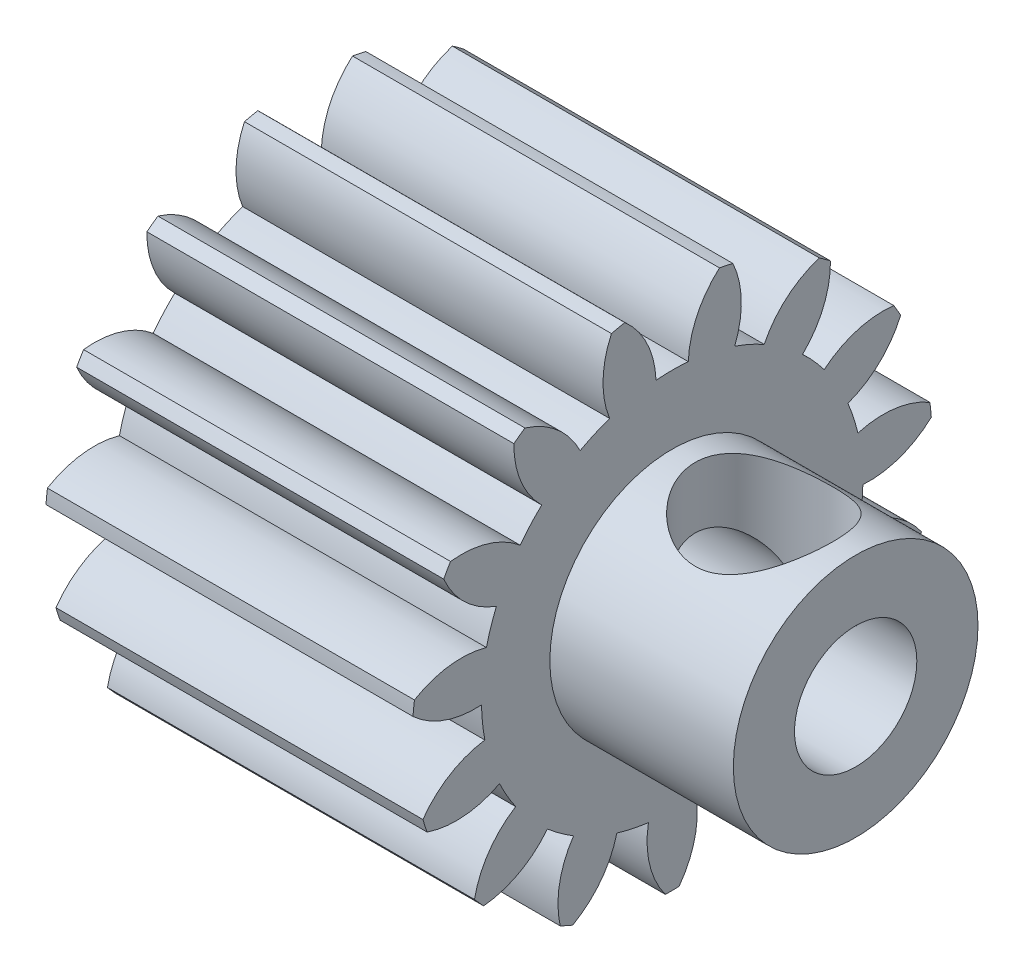
from build123d import *

# Parameters (mm, degrees)
SPUR_START             = -93.736960043
SPUR_GEAR_AI_OUTLINE_R = 1.5875
SPUR_GEAR_AI_DEPTH     = 9.525
SKETCH1_R              = 3.175
SKETCH1_R_2            = 1.5875
BOSS_EXTRUDE1_DEPTH    = 4.7625
SKETCH2_R              = 1.7859375
CUT_EXTRUDE1_DEPTH     = 3.175


# Read off the part's stored shape, not the designer's step: spur gear_ai
with BuildPart() as part:
    # spur gear_ai outline → spur gear_ai (new body)
    with BuildSketch(Plane.YZ.offset(SPUR_START)):
        with BuildLine():
            ThreePointArc((26.294144563, 31.128016902), (26.400392113, 31.270279151), (26.502859253, 31.415288028))
            ThreePointArc((26.502859253, 31.415288028), (26.037760207, 32.257629699), (25.277278274, 32.847141228))
            ThreePointArc((25.277278274, 32.847141228), (25.463945724, 33.222717571), (25.618148436, 33.612748146))
            ThreePointArc((25.618148436, 33.612748146), (26.565102615, 33.44206014), (27.502296476, 33.660060783))
            ThreePointArc((27.502296476, 33.660060783), (27.541495173, 33.833238586), (27.576123139, 34.007387928))
            ThreePointArc((27.576123139, 34.007387928), (26.808622795, 34.58773251), (25.874112039, 34.816962221))
            ThreePointArc((25.874112039, 34.816962221), (25.891880579, 35.235992775), (25.874112039, 35.655023329))
            ThreePointArc((25.874112039, 35.655023329), (26.808622795, 35.88425304), (27.576123139, 36.464597623))
            ThreePointArc((27.576123139, 36.464597623), (27.541495173, 36.638746964), (27.502296476, 36.811924767))
            ThreePointArc((27.502296476, 36.811924767), (26.565102615, 37.029925411), (25.618148436, 36.859237404))
            ThreePointArc((25.618148436, 36.859237404), (25.463945724, 37.249267979), (25.277278274, 37.624844322))
            ThreePointArc((25.277278274, 37.624844322), (26.037760207, 38.214355851), (26.502859253, 39.056697522))
            ThreePointArc((26.502859253, 39.056697522), (26.400392113, 39.201706399), (26.294144563, 39.343968648))
            ThreePointArc((26.294144563, 39.343968648), (25.349306519, 39.161931061), (24.553645896, 38.620838844))
            ThreePointArc((24.553645896, 38.620838844), (24.254134982, 38.914429611), (23.930845121, 39.181611181))
            ThreePointArc((23.930845121, 39.181611181), (24.385803996, 40.029472629), (24.468081893, 40.988162861))
            ThreePointArc((24.468081893, 40.988162861), (24.315493079, 41.078957921), (24.160567843, 41.165706181))
            ThreePointArc((24.160567843, 41.165706181), (23.371456696, 40.615106316), (22.864666581, 39.797169648))
            ThreePointArc((22.864666581, 39.797169648), (22.471635623, 39.943556096), (22.067623104, 40.056144773))
            ThreePointArc((22.067623104, 40.056144773), (22.138392398, 41.015753193), (21.823622551, 41.925025735))
            ThreePointArc((21.823622551, 41.925025735), (21.647296055, 41.945907688), (21.470481113, 41.962142396))
            ThreePointArc((21.470481113, 41.962142396), (20.97354135, 41.138183972), (20.843250357, 40.184831534))
            ThreePointArc((20.843250357, 40.184831534), (20.424657978, 40.158702116), (20.009780236, 40.097230294))
            ThreePointArc((20.009780236, 40.097230294), (19.684123296, 41.002660673), (19.02673227, 41.705294043))
            ThreePointArc((19.02673227, 41.705294043), (18.857156545, 41.652652209), (18.689024808, 41.595566237))
            ThreePointArc((18.689024808, 41.595566237), (18.570181828, 40.64071915), (18.838918453, 39.716794239))
            ThreePointArc((18.838918453, 39.716794239), (18.467143079, 39.522666969), (18.113136244, 39.297763686))
            ThreePointArc((18.113136244, 39.297763686), (17.447362113, 39.992458885), (16.56101879, 40.366961389))
            ThreePointArc((16.56101879, 40.366961389), (16.427515019, 40.24989802), (16.297137991, 40.129362051))
            ThreePointArc((16.297137991, 40.129362051), (16.576940826, 39.208728037), (17.198238065, 38.473985665))
            ThreePointArc((17.198238065, 38.473985665), (16.937563035, 38.145426912), (16.705638106, 37.795979987))
            ThreePointArc((16.705638106, 37.795979987), (15.81486518, 38.159820895), (14.852826371, 38.141437649))
            ThreePointArc((14.852826371, 38.141437649), (14.778478569, 37.980194064), (14.708399623, 37.817049862))
            ThreePointArc((14.708399623, 37.817049862), (15.33846782, 37.089814907), (16.204897737, 36.671298704))
            ThreePointArc((16.204897737, 36.671298704), (16.100396131, 36.26511926), (16.030655035, 35.851551242))
            ThreePointArc((16.030655035, 35.851551242), (15.068906044, 35.821626462), (14.197517, 35.413536095))
            ThreePointArc((14.197517, 35.413536095), (14.195180579, 35.235992775), (14.197517, 35.058449455))
            ThreePointArc((14.197517, 35.058449455), (15.068906044, 34.650359089), (16.030655035, 34.620434308))
            ThreePointArc((16.030655035, 34.620434308), (16.100396131, 34.20686629), (16.204897737, 33.800686847))
            ThreePointArc((16.204897737, 33.800686847), (15.33846782, 33.382170643), (14.708399623, 32.654935688))
            ThreePointArc((14.708399623, 32.654935688), (14.778478569, 32.491791486), (14.852826371, 32.330547901))
            ThreePointArc((14.852826371, 32.330547901), (15.81486518, 32.312164655), (16.705638106, 32.676005564))
            ThreePointArc((16.705638106, 32.676005564), (16.937563035, 32.326558639), (17.198238065, 31.997999885))
            ThreePointArc((17.198238065, 31.997999885), (16.576940826, 31.263257513), (16.297137991, 30.3426235))
            ThreePointArc((16.297137991, 30.3426235), (16.427515019, 30.222087531), (16.56101879, 30.105024161))
            ThreePointArc((16.56101879, 30.105024161), (17.447362114, 30.479526665), (18.113136244, 31.174221865))
            ThreePointArc((18.113136244, 31.174221865), (18.467143079, 30.949318581), (18.838918453, 30.755191311))
            ThreePointArc((18.838918453, 30.755191311), (18.570181828, 29.831266401), (18.689024808, 28.876419314))
            ThreePointArc((18.689024808, 28.876419314), (18.857156545, 28.819333342), (19.02673227, 28.766691508))
            ThreePointArc((19.02673227, 28.766691508), (19.684123296, 29.469324877), (20.009780236, 30.374755256))
            ThreePointArc((20.009780236, 30.374755256), (20.424657978, 30.313283434), (20.843250357, 30.287154017))
            ThreePointArc((20.843250357, 30.287154017), (20.97354135, 29.333801579), (21.470481113, 28.509843154))
            ThreePointArc((21.470481113, 28.509843154), (21.647296055, 28.526077862), (21.823622551, 28.546959815))
            ThreePointArc((21.823622551, 28.546959815), (22.138392398, 29.456232358), (22.067623104, 30.415840778))
            ThreePointArc((22.067623104, 30.415840778), (22.471635623, 30.528429454), (22.864666581, 30.674815902))
            ThreePointArc((22.864666581, 30.674815902), (23.371456696, 29.856879235), (24.160567843, 29.30627937))
            ThreePointArc((24.160567843, 29.30627937), (24.315493079, 29.393027629), (24.468081893, 29.483822689))
            ThreePointArc((24.468081893, 29.483822689), (24.385803996, 30.442512921), (23.930845121, 31.290374369))
            ThreePointArc((23.930845121, 31.290374369), (24.254134982, 31.557555939), (24.553645896, 31.851146706))
            ThreePointArc((24.553645896, 31.851146706), (25.349306519, 31.310054489), (26.294144563, 31.128016902))
        make_face()
        with Locations((20.942055579, 35.235992775)):
            Circle(SPUR_GEAR_AI_OUTLINE_R, mode=Mode.SUBTRACT)
    extrude(amount=SPUR_GEAR_AI_DEPTH)

    # Sketch1 → Boss-Extrude1 (add)
    with BuildSketch(Plane(origin=(-84.211960043, 0, 0), x_dir=(0, 0, -1), z_dir=(1, 0, 0))):
        with Locations(Location((-35.235992775, 20.942055579, 0), (0, 0, 180))):
            Circle(SKETCH1_R)
        with Locations((-35.235992775, 20.942055579)):
            Circle(SKETCH1_R_2, mode=Mode.SUBTRACT)
    extrude(amount=BOSS_EXTRUDE1_DEPTH)

    # Sketch2 → Cut-Extrude1 (cut)
    with BuildSketch(Plane(origin=(0, 24.117055579, 0), x_dir=(1, 0, 0), z_dir=(0, 1, 0))):
        with Locations(Location((-81.830710043, -35.235992775, 0), (0, 0, 270))):
            Circle(SKETCH2_R)
    extrude(amount=-CUT_EXTRUDE1_DEPTH, mode=Mode.SUBTRACT)


solid = part.part
